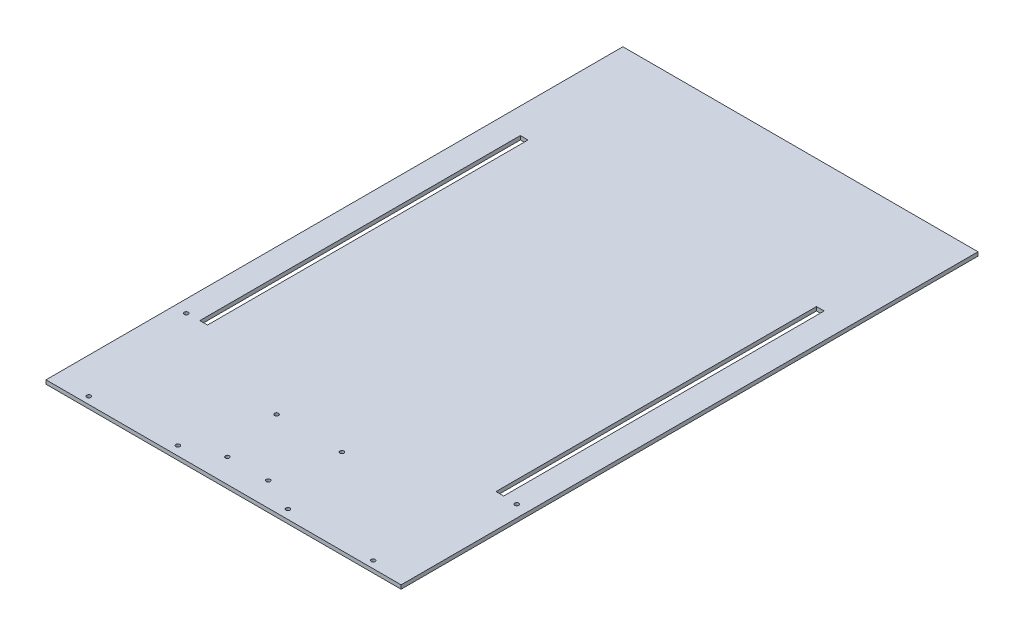
from build123d import *

# Parameters (mm, degrees)
SKETCH1_W           = 277
SKETCH1_H           = 3
BOSS_EXTRUDE1_DEPTH = 450
CUT_EXTRUDE1_REACH  = 520.295
SKETCH2_W           = 6
SKETCH2_H           = 250
CUT_EXTRUDE2_REACH  = 520.295
SKETCH3_R           = 1.55


with BuildPart() as part:
    # Sketch1 → Boss-Extrude1 (new body)
    with BuildSketch(Plane.XY):
        with Locations((-118.640040599, -13.427850278)):
            Rectangle(SKETCH1_W, SKETCH1_H)
    extrude(amount=BOSS_EXTRUDE1_DEPTH)

    # Sketch2 → Cut-Extrude1 (cut, up to next)
    with BuildSketch(Plane(origin=(0, -11.927850278, 0), x_dir=(1, 0, 0), z_dir=(0, 1, 0)), mode=Mode.PRIVATE) as cut_extrude1_sk1:
        with Locations((-234.140040599, -225)):
            Rectangle(SKETCH2_W, SKETCH2_H)
    cut_extrude1_tool1 = extrude(cut_extrude1_sk1.sketch, amount=-CUT_EXTRUDE1_REACH, mode=Mode.PRIVATE) & part.part
    # Sketch2 → Cut-Extrude1 (cut, up to next)
    with BuildSketch(Plane(origin=(0, -11.927850278, 0), x_dir=(1, 0, 0), z_dir=(0, 1, 0)), mode=Mode.PRIVATE) as cut_extrude1_sk2:
        with Locations((-3.140040599, -225)):
            Rectangle(SKETCH2_W, SKETCH2_H)
    cut_extrude1_tool2 = extrude(cut_extrude1_sk2.sketch, amount=-CUT_EXTRUDE1_REACH, mode=Mode.PRIVATE) & part.part
    add(cut_extrude1_tool1.solids().sort_by_distance((-234.140041, -11.92785, 225))[0], mode=Mode.SUBTRACT)
    add(cut_extrude1_tool2.solids().sort_by_distance((-3.140041, -11.92785, 225))[0], mode=Mode.SUBTRACT)

    # Sketch3 → Cut-Extrude2 (cut, up to next)
    with BuildSketch(Plane(origin=(0, -11.927850278, 0), x_dir=(1, 0, 0), z_dir=(0, 1, 0)), mode=Mode.PRIVATE) as cut_extrude2_sk1:
        with Locations((-102.460040599, -431.322984009)):
            Circle(SKETCH3_R)
    cut_extrude2_tool1 = extrude(cut_extrude2_sk1.sketch, amount=-CUT_EXTRUDE2_REACH, mode=Mode.PRIVATE) & part.part
    # Sketch3 → Cut-Extrude2 (cut, up to next)
    with BuildSketch(Plane(origin=(0, -11.927850278, 0), x_dir=(1, 0, 0), z_dir=(0, 1, 0)), mode=Mode.PRIVATE) as cut_extrude2_sk2:
        with Locations((-75.460040599, -442.983238046)):
            Circle(SKETCH3_R)
    cut_extrude2_tool2 = extrude(cut_extrude2_sk2.sketch, amount=-CUT_EXTRUDE2_REACH, mode=Mode.PRIVATE) & part.part
    # Sketch3 → Cut-Extrude2 (cut, up to next)
    with BuildSketch(Plane(origin=(0, -11.927850278, 0), x_dir=(1, 0, 0), z_dir=(0, 1, 0)), mode=Mode.PRIVATE) as cut_extrude2_sk3:
        with Locations((-92.910040599, -383.404829271)):
            Circle(SKETCH3_R)
    cut_extrude2_tool3 = extrude(cut_extrude2_sk3.sketch, amount=-CUT_EXTRUDE2_REACH, mode=Mode.PRIVATE) & part.part
    # Sketch3 → Cut-Extrude2 (cut, up to next)
    with BuildSketch(Plane(origin=(0, -11.927850278, 0), x_dir=(1, 0, 0), z_dir=(0, 1, 0)), mode=Mode.PRIVATE) as cut_extrude2_sk4:
        with Locations((10.539959401, -350.404829271)):
            Circle(SKETCH3_R)
    cut_extrude2_tool4 = extrude(cut_extrude2_sk4.sketch, amount=-CUT_EXTRUDE2_REACH, mode=Mode.PRIVATE) & part.part
    # Sketch3 → Cut-Extrude2 (cut, up to next)
    with BuildSketch(Plane(origin=(0, -11.927850278, 0), x_dir=(1, 0, 0), z_dir=(0, 1, 0)), mode=Mode.PRIVATE) as cut_extrude2_sk5:
        with Locations((-7.460040599, -444.433238046)):
            Circle(SKETCH3_R)
    cut_extrude2_tool5 = extrude(cut_extrude2_sk5.sketch, amount=-CUT_EXTRUDE2_REACH, mode=Mode.PRIVATE) & part.part
    # Sketch3 → Cut-Extrude2 (cut, up to next)
    with BuildSketch(Plane(origin=(0, -11.927850278, 0), x_dir=(1, 0, 0), z_dir=(0, 1, 0)), mode=Mode.PRIVATE) as cut_extrude2_sk6:
        with Locations((-247.340040599, -350.40562763)):
            Circle(SKETCH3_R)
    cut_extrude2_tool6 = extrude(cut_extrude2_sk6.sketch, amount=-CUT_EXTRUDE2_REACH, mode=Mode.PRIVATE) & part.part
    # Sketch3 → Cut-Extrude2 (cut, up to next)
    with BuildSketch(Plane(origin=(0, -11.927850278, 0), x_dir=(1, 0, 0), z_dir=(0, 1, 0)), mode=Mode.PRIVATE) as cut_extrude2_sk7:
        with Locations((-229.340040599, -444.434036405)):
            Circle(SKETCH3_R)
    cut_extrude2_tool7 = extrude(cut_extrude2_sk7.sketch, amount=-CUT_EXTRUDE2_REACH, mode=Mode.PRIVATE) & part.part
    # Sketch3 → Cut-Extrude2 (cut, up to next)
    with BuildSketch(Plane(origin=(0, -11.927850278, 0), x_dir=(1, 0, 0), z_dir=(0, 1, 0)), mode=Mode.PRIVATE) as cut_extrude2_sk8:
        with Locations((-161.340040599, -442.984036405)):
            Circle(SKETCH3_R)
    cut_extrude2_tool8 = extrude(cut_extrude2_sk8.sketch, amount=-CUT_EXTRUDE2_REACH, mode=Mode.PRIVATE) & part.part
    # Sketch3 → Cut-Extrude2 (cut, up to next)
    with BuildSketch(Plane(origin=(0, -11.927850278, 0), x_dir=(1, 0, 0), z_dir=(0, 1, 0)), mode=Mode.PRIVATE) as cut_extrude2_sk9:
        with Locations((-134.340040599, -431.323782367)):
            Circle(SKETCH3_R)
    cut_extrude2_tool9 = extrude(cut_extrude2_sk9.sketch, amount=-CUT_EXTRUDE2_REACH, mode=Mode.PRIVATE) & part.part
    # Sketch3 → Cut-Extrude2 (cut, up to next)
    with BuildSketch(Plane(origin=(0, -11.927850278, 0), x_dir=(1, 0, 0), z_dir=(0, 1, 0)), mode=Mode.PRIVATE) as cut_extrude2_sk10:
        with Locations((-143.890040599, -383.40562763)):
            Circle(SKETCH3_R)
    cut_extrude2_tool10 = extrude(cut_extrude2_sk10.sketch, amount=-CUT_EXTRUDE2_REACH, mode=Mode.PRIVATE) & part.part
    add(cut_extrude2_tool1.solids().sort_by_distance((-102.460041, -11.92785, 431.322984))[0], mode=Mode.SUBTRACT)
    add(cut_extrude2_tool2.solids().sort_by_distance((-75.460041, -11.92785, 442.983238))[0], mode=Mode.SUBTRACT)
    add(cut_extrude2_tool3.solids().sort_by_distance((-92.910041, -11.92785, 383.404829))[0], mode=Mode.SUBTRACT)
    add(cut_extrude2_tool4.solids().sort_by_distance((10.539959, -11.92785, 350.404829))[0], mode=Mode.SUBTRACT)
    add(cut_extrude2_tool5.solids().sort_by_distance((-7.460041, -11.92785, 444.433238))[0], mode=Mode.SUBTRACT)
    add(cut_extrude2_tool6.solids().sort_by_distance((-247.340041, -11.92785, 350.405628))[0], mode=Mode.SUBTRACT)
    add(cut_extrude2_tool7.solids().sort_by_distance((-229.340041, -11.92785, 444.434036))[0], mode=Mode.SUBTRACT)
    add(cut_extrude2_tool8.solids().sort_by_distance((-161.340041, -11.92785, 442.984036))[0], mode=Mode.SUBTRACT)
    add(cut_extrude2_tool9.solids().sort_by_distance((-134.340041, -11.92785, 431.323782))[0], mode=Mode.SUBTRACT)
    add(cut_extrude2_tool10.solids().sort_by_distance((-143.890041, -11.92785, 383.405628))[0], mode=Mode.SUBTRACT)


solid = part.part
